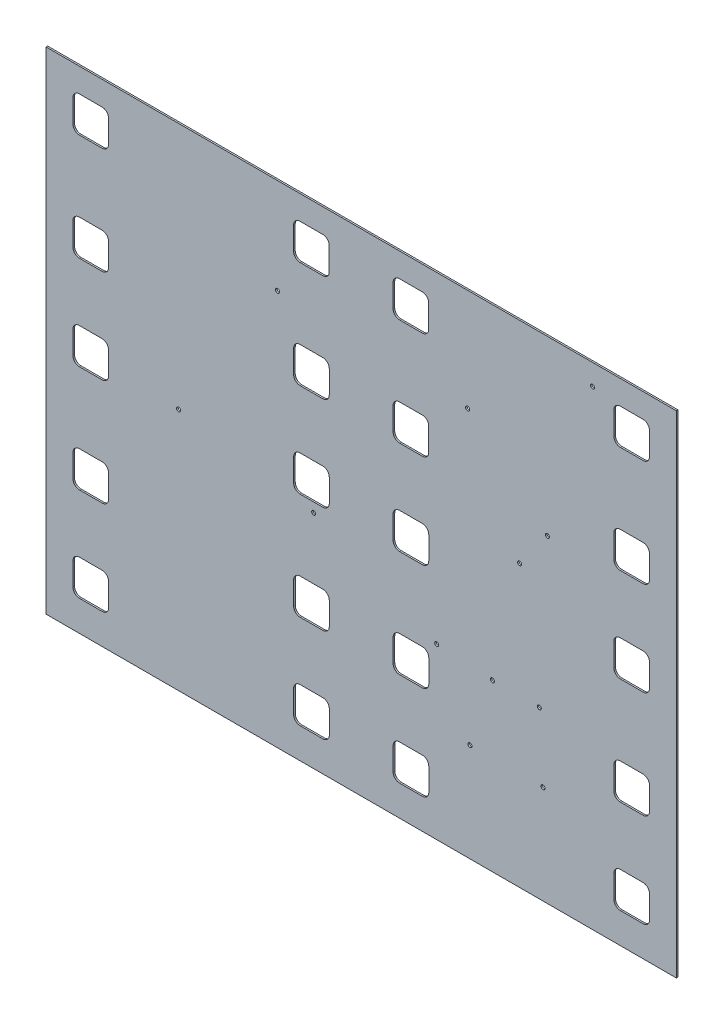
from build123d import *

# Parameters (mm, degrees)
BOSS_EXTRUDE2_DEPTH  = 1.5875
CUT_EXTRUDE6_DEPTH   = 570.657128967
LPATTERN2_COUNT      = 2
LPATTERN2_PITCH      = 217.5764
MIRROR1_COPY_1_DEPTH = 570.657128967
SKETCH11_R           = 1.9939
CUT_EXTRUDE7_DEPTH   = 570.657128967


with BuildPart() as part:
    # Sketch9 → Boss-Extrude2 (new body)
    with BuildSketch(Plane.XY):
        Polygon((-144.32459706, -311.513538284), (476.933999514, -311.448288512), (476.883139425, 172.802708817), (-144.375457148, 172.737459045), align=None)
    extrude(amount=BOSS_EXTRUDE2_DEPTH)

    # Sketch10 → Cut-Extrude6 (cut, through all)
    with BuildSketch(Plane.XY.offset(1.5875)):
        with BuildLine():
            ThreePointArc((-111.536959772, -153.814293782), (-116.026892468, -155.674637302), (-117.886292807, -160.164960677))
            Line((-117.886292807, -160.164960677), (-117.883937231, -182.592960554))
            ThreePointArc((-117.883937231, -182.592960554), (-116.023593711, -187.08289325), (-111.533270336, -188.942293589))
            Line((-111.533270336, -188.942293589), (-89.105270459, -188.939938013))
            ThreePointArc((-89.105270459, -188.939938013), (-84.615337763, -187.079594493), (-82.755937424, -182.589271117))
            Line((-82.755937424, -182.589271117), (-82.758293, -160.161271241))
            ThreePointArc((-82.758293, -160.161271241), (-84.61863652, -155.671338545), (-89.108959895, -153.811938206))
            Line((-89.108959895, -153.811938206), (-111.536959772, -153.814293782))
        make_face()
        with BuildLine():
            ThreePointArc((-111.527235931, -246.397293272), (-116.017168628, -248.257636792), (-117.876568966, -252.747960167))
            Line((-117.876568966, -252.747960167), (-117.87421339, -275.175960043))
            ThreePointArc((-117.87421339, -275.175960043), (-116.01386987, -279.665892739), (-111.523546495, -281.525293078))
            Line((-111.523546495, -281.525293078), (-89.095546619, -281.522937502))
            ThreePointArc((-89.095546619, -281.522937502), (-84.605613922, -279.662593982), (-82.746213584, -275.172270607))
            Line((-82.746213584, -275.172270607), (-82.74856916, -252.74427073))
            ThreePointArc((-82.74856916, -252.74427073), (-84.60891268, -248.254338034), (-89.099236055, -246.394937696))
            Line((-89.099236055, -246.394937696), (-111.527235931, -246.397293272))
        make_face()
        with BuildLine():
            ThreePointArc((-82.769334695, -55.030671821), (-84.629678215, -50.540739125), (-89.12000159, -48.681338786))
            Line((-89.12000159, -48.681338786), (-111.548001466, -48.683694362))
            ThreePointArc((-111.548001466, -48.683694362), (-116.037934163, -50.544037882), (-117.897334501, -55.034361257))
            Line((-117.897334501, -55.034361257), (-117.894978925, -77.462361134))
            ThreePointArc((-117.894978925, -77.462361134), (-116.034635405, -81.95229383), (-111.54431203, -83.811694168))
            Line((-111.54431203, -83.811694168), (-89.116312154, -83.809338592))
            ThreePointArc((-89.116312154, -83.809338592), (-84.626379457, -81.948995072), (-82.766979119, -77.458671697))
            Line((-82.766979119, -77.458671697), (-82.769334695, -55.030671821))
        make_face()
        with BuildLine():
            ThreePointArc((-89.137077689, 113.904260317), (-84.647144992, 115.764603837), (-82.787744654, 120.254927212))
            Line((-82.787744654, 120.254927212), (-82.79010023, 142.682927089))
            ThreePointArc((-82.79010023, 142.682927089), (-84.65044375, 147.172859785), (-89.140767125, 149.032260123))
            Line((-89.140767125, 149.032260123), (-111.568767001, 149.029904547))
            ThreePointArc((-111.568767001, 149.029904547), (-116.058699698, 147.169561027), (-117.918100036, 142.679237652))
            Line((-117.918100036, 142.679237652), (-117.91574446, 120.251237776))
            ThreePointArc((-117.91574446, 120.251237776), (-116.05540094, 115.76130508), (-111.565077565, 113.901904741))
            Line((-111.565077565, 113.901904741), (-89.137077689, 113.904260317))
        make_face()
        with BuildLine():
            ThreePointArc((-117.904702766, 15.120638356), (-116.044359246, 10.630705659), (-111.554035871, 8.771305321))
            Line((-111.554035871, 8.771305321), (-89.126035994, 8.773660897))
            ThreePointArc((-89.126035994, 8.773660897), (-84.636103298, 10.634004417), (-82.77670296, 15.124327792))
            Line((-82.77670296, 15.124327792), (-82.779058536, 37.552327668))
            ThreePointArc((-82.779058536, 37.552327668), (-84.639402056, 42.042260365), (-89.129725431, 43.901660703))
            Line((-89.129725431, 43.901660703), (-111.557725307, 43.899305127))
            ThreePointArc((-111.557725307, 43.899305127), (-116.047658003, 42.038961607), (-117.907058342, 37.548638232))
            Line((-117.907058342, 37.548638232), (-117.904702766, 15.120638356))
        make_face()
    cut_extrude6 = extrude(amount=-CUT_EXTRUDE6_DEPTH, mode=Mode.SUBTRACT)

    # LPattern2: Cut-Extrude6 ×2
    with Locations(*[Vector(0.9999999944845218, 0.0001050283601130813, 0) * (i * LPATTERN2_PITCH) for i in range(1, LPATTERN2_COUNT)]):
        add(cut_extrude6, mode=Mode.SUBTRACT)

    # Mirror1: Cut-Extrude6 across plane
    add(cut_extrude6.mirror(Plane(origin=(166.271985063, 0.017463274, 0), x_dir=(0, 0, 1), z_dir=(-0.9999999944845219, -0.00010502836011320445, 0))), mode=Mode.SUBTRACT)

    # Mirror1 copy 1 sketch → Mirror1 copy 1 (cut, through all)
    with BuildSketch(Plane(origin=(114.967571327, 0.012074856, 1.5875), x_dir=(-0.9999999779380877, -0.00021005671906784565, 0), z_dir=(0, 0, 1))):
        with BuildLine():
            ThreePointArc((-111.536959772, 153.814293782), (-116.026892468, 155.674637302), (-117.886292807, 160.164960677))
            Line((-117.886292807, 160.164960677), (-117.883937231, 182.592960554))
            ThreePointArc((-117.883937231, 182.592960554), (-116.023593711, 187.08289325), (-111.533270336, 188.942293589))
            Line((-111.533270336, 188.942293589), (-89.105270459, 188.939938013))
            ThreePointArc((-89.105270459, 188.939938013), (-84.615337763, 187.079594493), (-82.755937424, 182.589271117))
            Line((-82.755937424, 182.589271117), (-82.758293, 160.161271241))
            ThreePointArc((-82.758293, 160.161271241), (-84.61863652, 155.671338545), (-89.108959895, 153.811938206))
            Line((-89.108959895, 153.811938206), (-111.536959772, 153.814293782))
        make_face()
        with BuildLine():
            ThreePointArc((-111.527235931, 246.397293272), (-116.017168628, 248.257636792), (-117.876568966, 252.747960167))
            Line((-117.876568966, 252.747960167), (-117.87421339, 275.175960043))
            ThreePointArc((-117.87421339, 275.175960043), (-116.01386987, 279.665892739), (-111.523546495, 281.525293078))
            Line((-111.523546495, 281.525293078), (-89.095546619, 281.522937502))
            ThreePointArc((-89.095546619, 281.522937502), (-84.605613922, 279.662593982), (-82.746213584, 275.172270607))
            Line((-82.746213584, 275.172270607), (-82.74856916, 252.74427073))
            ThreePointArc((-82.74856916, 252.74427073), (-84.60891268, 248.254338034), (-89.099236055, 246.394937696))
            Line((-89.099236055, 246.394937696), (-111.527235931, 246.397293272))
        make_face()
        with BuildLine():
            ThreePointArc((-82.769334695, 55.030671821), (-84.629678215, 50.540739125), (-89.12000159, 48.681338786))
            Line((-89.12000159, 48.681338786), (-111.548001466, 48.683694362))
            ThreePointArc((-111.548001466, 48.683694362), (-116.037934163, 50.544037882), (-117.897334501, 55.034361257))
            Line((-117.897334501, 55.034361257), (-117.894978925, 77.462361134))
            ThreePointArc((-117.894978925, 77.462361134), (-116.034635405, 81.95229383), (-111.54431203, 83.811694168))
            Line((-111.54431203, 83.811694168), (-89.116312154, 83.809338592))
            ThreePointArc((-89.116312154, 83.809338592), (-84.626379457, 81.948995072), (-82.766979119, 77.458671697))
            Line((-82.766979119, 77.458671697), (-82.769334695, 55.030671821))
        make_face()
        with BuildLine():
            ThreePointArc((-89.137077689, -113.904260317), (-84.647144992, -115.764603837), (-82.787744654, -120.254927212))
            Line((-82.787744654, -120.254927212), (-82.79010023, -142.682927089))
            ThreePointArc((-82.79010023, -142.682927089), (-84.65044375, -147.172859785), (-89.140767125, -149.032260123))
            Line((-89.140767125, -149.032260123), (-111.568767001, -149.029904547))
            ThreePointArc((-111.568767001, -149.029904547), (-116.058699698, -147.169561027), (-117.918100036, -142.679237652))
            Line((-117.918100036, -142.679237652), (-117.91574446, -120.251237776))
            ThreePointArc((-117.91574446, -120.251237776), (-116.05540094, -115.76130508), (-111.565077565, -113.901904741))
            Line((-111.565077565, -113.901904741), (-89.137077689, -113.904260317))
        make_face()
        with BuildLine():
            ThreePointArc((-117.904702766, -15.120638356), (-116.044359246, -10.630705659), (-111.554035871, -8.771305321))
            Line((-111.554035871, -8.771305321), (-89.126035994, -8.773660897))
            ThreePointArc((-89.126035994, -8.773660897), (-84.636103298, -10.634004417), (-82.77670296, -15.124327792))
            Line((-82.77670296, -15.124327792), (-82.779058536, -37.552327668))
            ThreePointArc((-82.779058536, -37.552327668), (-84.639402056, -42.042260365), (-89.129725431, -43.901660703))
            Line((-89.129725431, -43.901660703), (-111.557725307, -43.899305127))
            ThreePointArc((-111.557725307, -43.899305127), (-116.047658003, -42.038961607), (-117.907058342, -37.548638232))
            Line((-117.907058342, -37.548638232), (-117.904702766, -15.120638356))
        make_face()
    extrude(amount=-MIRROR1_COPY_1_DEPTH, mode=Mode.SUBTRACT)

    # Sketch11 → Cut-Extrude7 (cut, through all)
    with BuildSketch(Plane.XY.offset(1.5875)):
        with Locations((295.654327064, -147.954827117)):
            Circle(SKETCH11_R)
        with Locations((394.335307404, 152.15653884)):
            Circle(SKETCH11_R)
        with Locations((271.193740547, 71.85610504)):
            Circle(SKETCH11_R)
        with Locations((83.796928701, 78.623923098)):
            Circle(SKETCH11_R)
        with Locations((-13.737316507, -71.386321592)):
            Circle(SKETCH11_R)
        with Locations((349.92453176, 2.438864357)):
            Circle(SKETCH11_R)
        with Locations((322.428430983, -34.688005186)):
            Circle(SKETCH11_R)
        with Locations((341.854326809, -147.949974807)):
            Circle(SKETCH11_R)
        with Locations((345.511300672, -214.349591087)):
            Circle(SKETCH11_R)
        with Locations((119.406061758, -93.07123788)):
            Circle(SKETCH11_R)
        with Locations((240.696463223, -144.493499232)):
            Circle(SKETCH11_R)
        with Locations((273.511301069, -214.357153129)):
            Circle(SKETCH11_R)
    extrude(amount=-CUT_EXTRUDE7_DEPTH, mode=Mode.SUBTRACT)


solid = part.part
